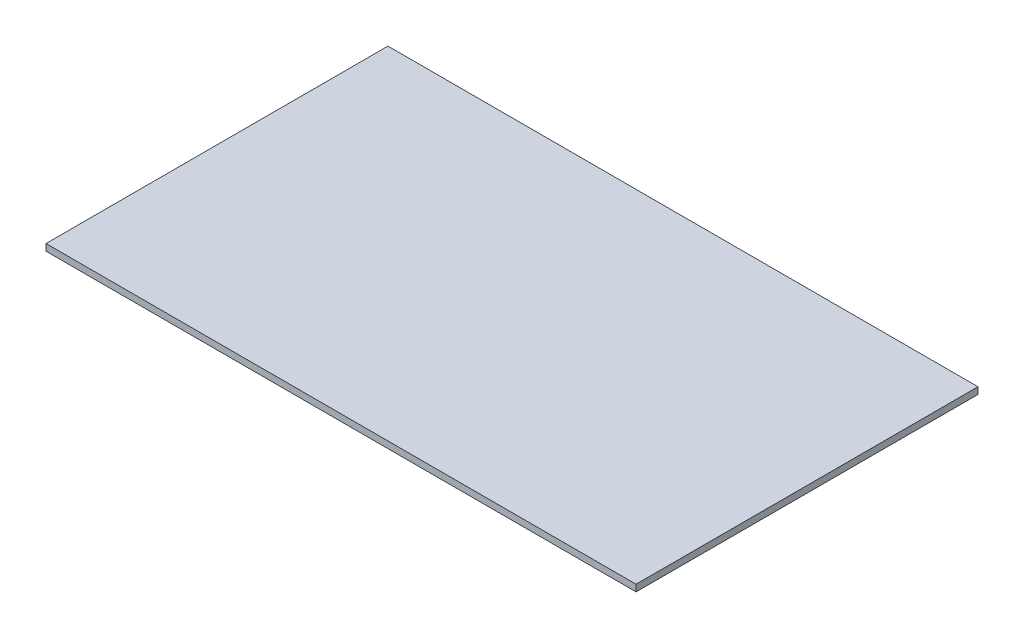
from build123d import *

# Parameters (mm, degrees)
SKETCH1_W           = 283
SKETCH1_H           = 164
BOSS_EXTRUDE1_DEPTH = 3.2


with BuildPart() as part:
    # Sketch1 → Boss-Extrude1 (new body)
    with BuildSketch(Plane(origin=(0, 0, 0), x_dir=(1, 0, 0), z_dir=(0, 1, 0))):
        Rectangle(SKETCH1_W, SKETCH1_H)
    extrude(amount=BOSS_EXTRUDE1_DEPTH)


solid = part.part
